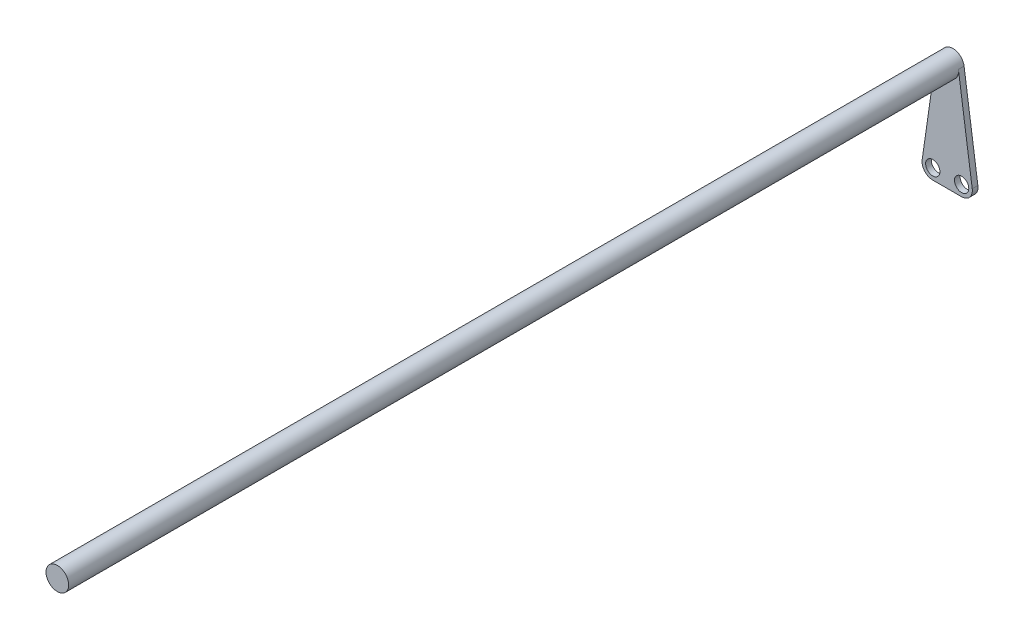
from build123d import *

# Parameters (mm, degrees)
SKETCH1_R           = 6.35
BOSS_EXTRUDE1_DEPTH = 250
BOSS_EXTRUDE2_DEPTH = 1.5875
CUT_EXTRUDE1_REACH  = 504.208
SKETCH3_R           = 4


with BuildPart() as part:
    # Sketch1 → Boss-Extrude1 (new, symmetric)
    with BuildSketch(Plane.XY):
        Circle(SKETCH1_R)
    extrude(amount=BOSS_EXTRUDE1_DEPTH, both=True)

    # Sketch2 → Boss-Extrude2 (add, symmetric)
    with BuildSketch(Plane(origin=(0, 0, -250), x_dir=(-1, 0, 0), z_dir=(0, 0, -1))):
        with BuildLine():
            Line((-6.285975, 0.899452), (-14.01986, -53.150124))
            ThreePointArc((-14.01986, -53.150124), (-12.613526, -57.930696), (-8.080356, -60))
            Line((-8.080356, -60), (8.080356, -60))
            ThreePointArc((8.080356, -60), (12.613526, -57.930696), (14.01986, -53.150124))
            Line((14.01986, -53.150124), (6.285975, 0.899452))
            ThreePointArc((6.285975, 0.899452), (0, 6.35), (-6.285975, 0.899452))
        make_face()
    extrude(amount=BOSS_EXTRUDE2_DEPTH, both=True)

    # Sketch3 → Cut-Extrude1 (cut, up to next)
    with BuildSketch(Plane.XY.offset(-248.4125), mode=Mode.PRIVATE) as cut_extrude1_sk1:
        with Locations((-8.080356, -54)):
            Circle(SKETCH3_R)
    cut_extrude1_tool1 = extrude(cut_extrude1_sk1.sketch, amount=-CUT_EXTRUDE1_REACH, mode=Mode.PRIVATE) & part.part
    # Sketch3 → Cut-Extrude1 (cut, up to next)
    with BuildSketch(Plane.XY.offset(-248.4125), mode=Mode.PRIVATE) as cut_extrude1_sk2:
        with Locations((8.080356, -54)):
            Circle(SKETCH3_R)
    cut_extrude1_tool2 = extrude(cut_extrude1_sk2.sketch, amount=-CUT_EXTRUDE1_REACH, mode=Mode.PRIVATE) & part.part
    add(cut_extrude1_tool1.solids().sort_by_distance((-8.080356, -54, -248.4125))[0], mode=Mode.SUBTRACT)
    add(cut_extrude1_tool2.solids().sort_by_distance((8.080356, -54, -248.4125))[0], mode=Mode.SUBTRACT)


solid = part.part
